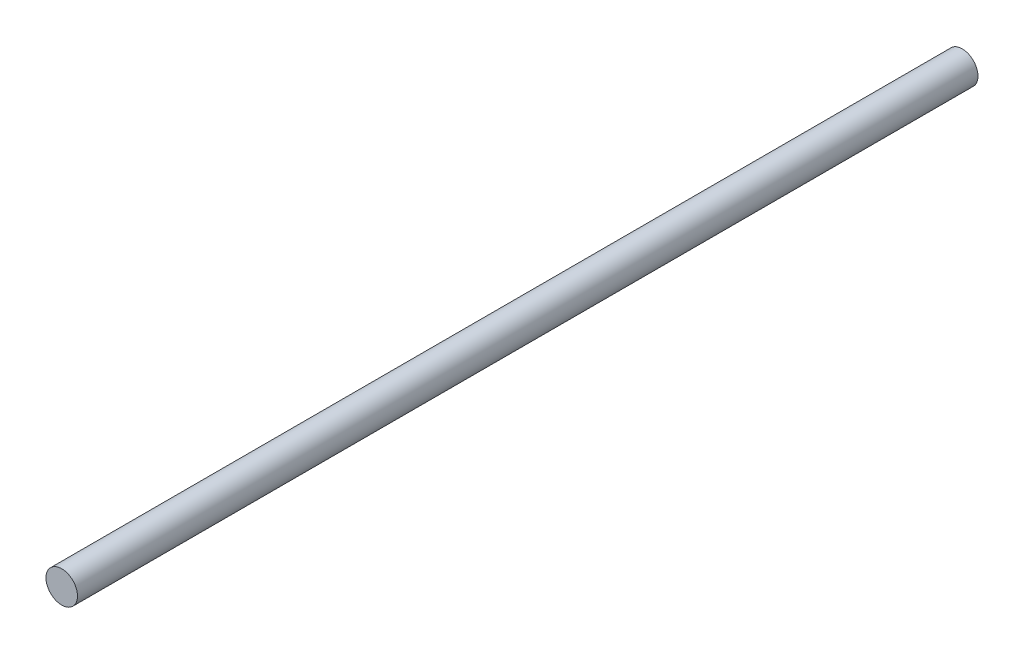
from build123d import *

# Parameters (mm, degrees)
SKETCH1_R           = 3.1115
BOSS_EXTRUDE1_DEPTH = 177.8


with BuildPart() as part:
    # Sketch1 → Boss-Extrude1 (new body)
    with BuildSketch(Plane.XY):
        Circle(SKETCH1_R)
    extrude(amount=BOSS_EXTRUDE1_DEPTH)


solid = part.part
